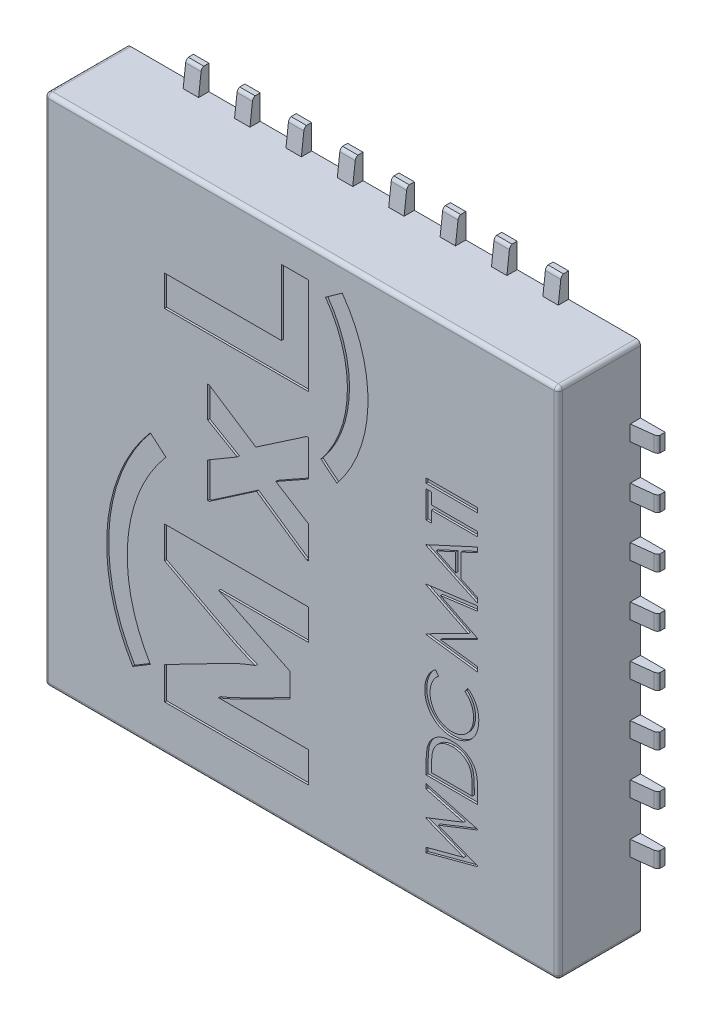
from build123d import *

# Parameters (mm, degrees)
SKETCH1_W            = 5
SKETCH1_H            = 5
BOSS_EXTRUDE1_DEPTH  = 0.8
SKETCH2_W            = 0.5
SKETCH2_H            = 0.044871795
CUT_EXTRUDE1_DEPTH   = 0.02
SKETCH3_W            = 0.15
SKETCH3_H            = 0.24
BOSS_EXTRUDE2_DEPTH  = 0.1
CUT_EXTRUDE2_DEPTH   = 6.161162759
LPATTERN1_COUNT      = 8
LPATTERN1_PITCH      = 0.5
SKETCH4_R            = 0.544852013
BOSS_EXTRUDE3_DEPTH  = 0.1
CIRPATTERN1_ANGLE    = 90
CIRPATTERN1_2_ANGLE  = 180
CIRPATTERN1_3_ANGLE  = 90
CIRPATTERN1_4_ANGLE  = 90
CIRPATTERN1_5_ANGLE  = 180
CIRPATTERN1_6_ANGLE  = 90
CIRPATTERN1_7_ANGLE  = 90
CIRPATTERN1_8_ANGLE  = 180
CIRPATTERN1_9_ANGLE  = 90
CIRPATTERN1_10_ANGLE = 90
CIRPATTERN1_11_ANGLE = 180
CIRPATTERN1_12_ANGLE = 90
CIRPATTERN1_13_ANGLE = 90
CIRPATTERN1_14_ANGLE = 180
CIRPATTERN1_15_ANGLE = 90
CIRPATTERN1_16_ANGLE = 90
CIRPATTERN1_17_ANGLE = 180
CIRPATTERN1_18_ANGLE = 90
CIRPATTERN1_19_ANGLE = 90
CIRPATTERN1_20_ANGLE = 180
CIRPATTERN1_21_ANGLE = 90
CIRPATTERN1_22_ANGLE = 90
CIRPATTERN1_23_ANGLE = 180
CIRPATTERN1_24_ANGLE = 90
FILLET3_R            = 0.04
FILLET4_R            = 0.04


with BuildPart() as part:
    # Sketch1 → Boss-Extrude1 (new body)
    with BuildSketch(Plane.XY):
        Rectangle(SKETCH1_W, SKETCH1_H)
    extrude(amount=BOSS_EXTRUDE1_DEPTH)

    # Sketch2 → Cut-Extrude1 (cut)
    # profile 1 of 12: a face of its own
    with BuildSketch(Plane.XY.offset(0.8)):
        with BuildLine():
            Line((-1.469427938, -1.810456241), (-1.640551868, -1.913977256))
            ThreePointArc((-1.640551868, -1.913977256), (-1.888188172, -0.858703712), (-1.469464766, 0.141094618))
            Line((-1.469464766, 0.141094618), (-1.317814393, 0.010702271))
            ThreePointArc((-1.317814393, 0.010702271), (-1.688877666, -0.875296541), (-1.469427938, -1.810456241))
        make_face()
    # profile 2 of 12: a face of its own
    with BuildSketch(Plane.XY.offset(0.8)):
        with BuildLine():
            Line((0.191028275, 0.749954179), (0.345848734, 0.623342072))
            ThreePointArc((0.345848734, 0.623342072), (0.647735773, 1.428628412), (0.397695478, 2.251490323))
            Line((0.397695478, 2.251490323), (0.235133187, 2.134984951))
            ThreePointArc((0.235133187, 2.134984951), (0.4478371, 1.434993984), (0.191028275, 0.749954179))
        make_face()
    # profile 3 of 12: a face of its own
    with BuildSketch(Plane.XY.offset(0.8)):
        with BuildLine():
            Line((-1.330798354, -0.558), (0.069201646, -0.558))
            Line((0.069201646, -0.558), (0.069201646, -0.856125))
            Line((0.069201646, -0.856125), (-0.804548354, -0.856125))
            add(Edge.make_bspline(
                [(-0.804548354, -0.856125), (-0.790222619, -0.861404164), (-0.75917042, -0.872847182), (-0.710342689, -0.894426012), (-0.655174384, -0.920482512), (-0.616587896, -0.939888924), (-0.596110854, -0.9501875)],
                knots=[0, 0, 0, 0, 0.80047453, 1.735093889, 2.798061757, 4, 4, 4, 4], degree=3))
            Line((-0.596110854, -0.9501875), (-0.110798354, -1.1895625))
            Line((-0.110798354, -1.1895625), (-0.110798354, -1.422375))
            Line((-0.110798354, -1.422375), (-0.596110854, -1.6658125))
            add(Edge.make_bspline(
                [(-0.596110854, -1.6658125), (-0.616791178, -1.676122895), (-0.655781757, -1.695562064), (-0.711370587, -1.721379834), (-0.759947362, -1.743017306), (-0.790540294, -1.754580418), (-0.804548354, -1.759875)],
                knots=[0, 0, 0, 0, 1.211919646, 2.284947304, 3.214702226, 4, 4, 4, 4], degree=3))
            Line((-0.804548354, -1.759875), (0.069201646, -1.759875))
            Line((0.069201646, -1.759875), (0.069201646, -2.058))
            Line((0.069201646, -2.058), (-1.330798354, -2.058))
            Line((-1.330798354, -2.058), (-1.330798354, -1.7426875))
            Line((-1.330798354, -1.7426875), (-0.720798354, -1.428))
            add(Edge.make_bspline(
                [(-0.720798354, -1.428), (-0.696922488, -1.416058329), (-0.649150405, -1.392164808), (-0.588536655, -1.36501469), (-0.540632538, -1.345189641), (-0.507106661, -1.331340531), (-0.475720433, -1.319412858), (-0.45550052, -1.312334111), (-0.445798354, -1.3089375)],
                knots=[0, 0, 0, 0, 1.602240096, 3.205845939, 3.984992466, 4.714142413, 5.383004098, 6, 6, 6, 6], degree=3))
            add(Edge.make_bspline(
                [(-0.445798354, -1.3089375), (-0.454468531, -1.306196117), (-0.472661002, -1.300443923), (-0.500914978, -1.289864605), (-0.531713821, -1.277830683), (-0.564879651, -1.263594756), (-0.60053742, -1.247830381), (-0.638294205, -1.229344035), (-0.678907836, -1.209953583), (-0.706558399, -1.195875282), (-0.720798354, -1.188625)],
                knots=[0, 0, 0, 0, 0.726111312, 1.523585883, 2.408791771, 3.366803565, 4.405774155, 5.522069931, 6.723873634, 8, 8, 8, 8], degree=3))
            Line((-0.720798354, -1.188625), (-1.330798354, -0.8689375))
            Line((-1.330798354, -0.8689375), (-1.330798354, -0.558))
        make_face()
    # profile 4 of 12: a face of its own
    with BuildSketch(Plane.XY.offset(0.8)):
        Polygon((-0.442673354, 0.53375), (0.051701646, 0.87), (0.069201646, 0.87), (0.069201646, 0.52), (-0.248610854, 0.340625), (0.069201646, 0.143125), (0.069201646, -0.17), (0.051701646, -0.17), (-0.436110854, 0.1646875), (-0.895485854, -0.15), (-0.910798354, -0.15), (-0.910798354, 0.1915625), (-0.623298354, 0.36), (-0.910798354, 0.5275), (-0.910798354, 0.83), (-0.895485854, 0.83), align=None)
    # profile 5 of 12: a face of its own
    with BuildSketch(Plane.XY.offset(0.8)):
        Polygon((-0.194235854, 1.556125), (-0.194235854, 2.198), (0.069201646, 2.198), (0.069201646, 1.258), (-1.330798354, 1.258), (-1.330798354, 1.556125), align=None)
    # profile 6 of 12: a face of its own
    with BuildSketch(Plane.XY.offset(0.8)):
        Polygon((1.213774316, -2.056738048), (1.213774316, -2.010363849), (1.580461014, -1.912507279), (1.213774316, -1.766974426), (1.213774316, -1.76046401), (1.577957008, -1.617635484), (1.213774316, -1.519278112), (1.213774316, -1.473404715), (1.713774316, -1.60822042), (1.713774316, -1.614630676), (1.331362457, -1.765071382), (1.713774316, -1.917314971), (1.713774316, -1.923725228), align=None)
    # profile 7 of 12: a face of its own
    with BuildSketch(Plane.XY.offset(0.8)):
        with BuildLine():
            Line((1.713774316, -1.400327792), (1.213774316, -1.400327792))
            Line((1.213774316, -1.400327792), (1.213774316, -1.299366253))
            add(Edge.make_bspline(
                [(1.213774316, -1.299366253), (1.21383754, -1.290584969), (1.213959689, -1.273619574), (1.214734173, -1.24910351), (1.21610424, -1.226420116), (1.218099887, -1.205643993), (1.22055032, -1.186718106), (1.223621806, -1.169695447), (1.227248688, -1.154487998), (1.230340895, -1.145135221), (1.231803162, -1.140712407)],
                knots=[0, 0, 0, 0, 1.314313732, 2.53924729, 3.670748893, 4.714932338, 5.66265055, 6.526160246, 7.303039223, 8, 8, 8, 8], degree=3))
            add(Edge.make_bspline(
                [(1.231803162, -1.140712407), (1.234006862, -1.134926923), (1.238364289, -1.123487151), (1.246596584, -1.107207983), (1.255885819, -1.091830741), (1.266445767, -1.077478027), (1.278138532, -1.064113828), (1.290880582, -1.051586464), (1.304954974, -1.040204797), (1.320111194, -1.029791559), (1.336155048, -1.02040014), (1.353060259, -1.012237568), (1.370739807, -1.005458381), (1.389144843, -0.99983079), (1.40831575, -0.995395578), (1.428274875, -0.992369589), (1.44894333, -0.990373733), (1.462968253, -0.990173154), (1.470084412, -0.990071382)],
                knots=[0, 0, 0, 0, 0.984741985, 1.947153288, 2.898543998, 3.841229145, 4.778974371, 5.722123648, 6.681464302, 7.655713756, 8.646344578, 9.637374342, 10.639946623, 11.656849581, 12.698333139, 13.76849723, 14.867749466, 16, 16, 16, 16], degree=3))
            add(Edge.make_bspline(
                [(1.470084412, -0.990071382), (1.476264589, -0.990161234), (1.488443273, -0.990338298), (1.506391973, -0.991928199), (1.523808194, -0.994239106), (1.540609019, -0.997816835), (1.556941583, -1.002160099), (1.572632046, -1.007726231), (1.587823497, -1.014103374), (1.602313628, -1.021536703), (1.616032849, -1.029708361), (1.628975358, -1.038423189), (1.640853959, -1.047878832), (1.651979923, -1.057795432), (1.662056032, -1.068412128), (1.671265962, -1.079599661), (1.679455517, -1.09140151), (1.686753389, -1.103890731), (1.693279674, -1.117234122), (1.698723379, -1.131851399), (1.703438183, -1.147673323), (1.70718881, -1.164790123), (1.710213718, -1.183140748), (1.712227713, -1.202776104), (1.713593582, -1.223659082), (1.713712901, -1.237999026), (1.713774316, -1.245379875)],
                knots=[0, 0, 0, 0, 1.106010661, 2.179509527, 3.223302912, 4.248870533, 5.252098245, 6.246278179, 7.226402005, 8.199283979, 9.158616973, 10.083547221, 10.989831858, 11.874256832, 12.749262829, 13.607058236, 14.46581075, 15.317568432, 16.194266721, 17.121067875, 18.106207572, 19.147242834, 20.255495536, 21.43354536, 22.679031616, 24, 24, 24, 24], degree=3))
            Line((1.713774316, -1.245379875), (1.713774316, -1.400327792))
        make_face()
        with BuildLine():
            Line((1.662492264, -1.355455997), (1.662492264, -1.29806417))
            add(Edge.make_bspline(
                [(1.662492264, -1.29806417), (1.662456822, -1.28981726), (1.662388653, -1.273955432), (1.661790482, -1.251147146), (1.660813062, -1.230307232), (1.659445194, -1.211432731), (1.657635391, -1.194534299), (1.655617548, -1.17957662), (1.653103627, -1.166608726), (1.650824918, -1.158761664), (1.649771912, -1.155135484)],
                knots=[0, 0, 0, 0, 1.375205317, 2.645023457, 3.804390687, 4.853969522, 5.800190428, 6.637939096, 7.370582563, 8, 8, 8, 8], degree=3))
            add(Edge.make_bspline(
                [(1.649771912, -1.155135484), (1.648164547, -1.150571432), (1.644988208, -1.14155234), (1.639194252, -1.128569334), (1.632331115, -1.116461166), (1.624702161, -1.105016969), (1.616038664, -1.09439853), (1.606527704, -1.084482095), (1.596125826, -1.075279805), (1.584849899, -1.0669334), (1.572822195, -1.059373477), (1.560021442, -1.052883601), (1.546627601, -1.047231769), (1.53253224, -1.042756542), (1.517838671, -1.039228021), (1.502470701, -1.036754725), (1.48644193, -1.035219266), (1.475529958, -1.03503621), (1.469984252, -1.034943176)],
                knots=[0, 0, 0, 0, 0.998590647, 1.973329978, 2.929871262, 3.868367705, 4.809062953, 5.754642869, 6.701828697, 7.672172887, 8.647399344, 9.630604387, 10.631475358, 11.644913558, 12.679592956, 13.747988925, 14.855477812, 16, 16, 16, 16], degree=3))
            add(Edge.make_bspline(
                [(1.469984252, -1.034943176), (1.464136611, -1.035016503), (1.452648871, -1.035160554), (1.435793057, -1.03697117), (1.419581536, -1.039617107), (1.404013222, -1.043443347), (1.389057743, -1.048319187), (1.374797813, -1.054404136), (1.361082832, -1.06135651), (1.348229351, -1.069628415), (1.336073193, -1.078687786), (1.324936776, -1.088741769), (1.314794733, -1.099630631), (1.305489117, -1.11123561), (1.297394306, -1.123883767), (1.290153352, -1.137277151), (1.284008225, -1.151612247), (1.280739816, -1.161585489), (1.279078803, -1.166653914)],
                knots=[0, 0, 0, 0, 1.122418816, 2.205001699, 3.251619955, 4.274784885, 5.280384055, 6.268708349, 7.249350384, 8.229342522, 9.199999885, 10.157847722, 11.105861043, 12.055065948, 13.010012805, 13.98527497, 14.976112212, 16, 16, 16, 16], degree=3))
            add(Edge.make_bspline(
                [(1.279078803, -1.166653914), (1.277919313, -1.170846934), (1.27545392, -1.179762447), (1.272764581, -1.194310942), (1.27039251, -1.210684535), (1.268384218, -1.228955921), (1.266943172, -1.249104272), (1.265861556, -1.271145085), (1.265132037, -1.295087885), (1.265082222, -1.31168539), (1.265056367, -1.320299747)],
                knots=[0, 0, 0, 0, 0.674548936, 1.434276114, 2.292660221, 3.240891867, 4.284742987, 5.42552168, 6.663806718, 8, 8, 8, 8], degree=3))
            Line((1.265056367, -1.320299747), (1.265056367, -1.355455997))
            Line((1.265056367, -1.355455997), (1.662492264, -1.355455997))
        make_face(mode=Mode.SUBTRACT)
    # profile 8 of 12: a face of its own
    with BuildSketch(Plane.XY.offset(0.8)):
        with BuildLine():
            Line((1.305521111, -0.46827651), (1.335569187, -0.50753933))
            add(Edge.make_bspline(
                [(1.335569187, -0.50753933), (1.332231236, -0.5103402), (1.325600336, -0.515904178), (1.316288323, -0.524855071), (1.307567142, -0.534185455), (1.299380756, -0.54388235), (1.292058193, -0.554170163), (1.285029167, -0.5646569), (1.278875013, -0.575723591), (1.271356944, -0.590949), (1.263682895, -0.610944094), (1.257082551, -0.636027643), (1.252920525, -0.662248474), (1.252466692, -0.680133162), (1.252235854, -0.689230035)],
                knots=[0, 0, 0, 0, 0.75789156, 1.505565099, 2.245254514, 2.979266606, 3.711207489, 4.440978832, 5.174393176, 5.91211879, 7.394186119, 8.890401545, 10.418332761, 12, 12, 12, 12], degree=3))
            add(Edge.make_bspline(
                [(1.252235854, -0.689230035), (1.252293563, -0.694241935), (1.252408445, -0.70421922), (1.253924035, -0.719026145), (1.256054207, -0.733556581), (1.259214968, -0.747801076), (1.263211056, -0.761741499), (1.267986116, -0.775468984), (1.273893948, -0.788784786), (1.280423706, -0.801873097), (1.287799032, -0.814413017), (1.295843883, -0.826277906), (1.304467722, -0.837425186), (1.31370476, -0.847861133), (1.323506454, -0.857605774), (1.333982614, -0.866536489), (1.345021247, -0.874772599), (1.35663152, -0.882267163), (1.368705302, -0.889014012), (1.381311526, -0.894687062), (1.394234349, -0.899641866), (1.407565384, -0.903624243), (1.421216026, -0.906751876), (1.435242826, -0.908914178), (1.44961919, -0.910412203), (1.45936336, -0.910526559), (1.464275117, -0.910584202)],
                knots=[0, 0, 0, 0, 1.054877232, 2.099964208, 3.13098259, 4.145888998, 5.169474743, 6.183358035, 7.203388855, 8.234598956, 9.261847606, 10.264062591, 11.251197969, 12.227332808, 13.196685059, 14.158975844, 15.123498106, 16.094582253, 17.066912473, 18.032714859, 19.002806091, 19.979168736, 20.95977404, 21.949109834, 22.966205168, 24, 24, 24, 24], degree=3))
            add(Edge.make_bspline(
                [(1.464275117, -0.910584202), (1.471665141, -0.910403519), (1.486174472, -0.910048773), (1.507429755, -0.906905011), (1.527811878, -0.902089384), (1.547182835, -0.894990235), (1.565704106, -0.88606193), (1.583151083, -0.874921866), (1.59977937, -0.861970888), (1.615186239, -0.847076136), (1.62925943, -0.830732016), (1.641652422, -0.813196714), (1.651983106, -0.794513214), (1.660579674, -0.774887989), (1.667187777, -0.754169971), (1.671839794, -0.732396428), (1.674874392, -0.709614715), (1.675164918, -0.694047658), (1.675312777, -0.686125067)],
                knots=[0, 0, 0, 0, 1.029159485, 2.020618137, 2.987588728, 3.942669054, 4.889339625, 5.846988364, 6.821327795, 7.821533711, 8.827683044, 9.822769455, 10.807800696, 11.797391277, 12.803701919, 13.832062008, 14.896664671, 16, 16, 16, 16], degree=3))
            add(Edge.make_bspline(
                [(1.675312777, -0.686125067), (1.675071523, -0.677396112), (1.674596677, -0.660215439), (1.670573927, -0.635020007), (1.664051367, -0.610900612), (1.654923093, -0.587855957), (1.643056623, -0.565951007), (1.628671212, -0.545151484), (1.611630022, -0.525439831), (1.598618146, -0.513586791), (1.591979444, -0.50753933)],
                knots=[0, 0, 0, 0, 1.028121516, 2.023589091, 2.998037872, 3.967518031, 4.937445131, 5.927275754, 6.942489185, 8, 8, 8, 8], degree=3))
            Line((1.591979444, -0.50753933), (1.62172704, -0.46827651))
            add(Edge.make_bspline(
                [(1.62172704, -0.46827651), (1.625803821, -0.47143635), (1.633937854, -0.477740897), (1.645407334, -0.487947542), (1.656185808, -0.49870758), (1.666219448, -0.510048669), (1.675549785, -0.521990798), (1.684181888, -0.534532871), (1.692069947, -0.547664183), (1.699315515, -0.561280433), (1.705694993, -0.575412997), (1.711348142, -0.589937459), (1.716028325, -0.604942877), (1.719987235, -0.620302936), (1.722810116, -0.63615636), (1.725058037, -0.652318865), (1.72639167, -0.668941726), (1.726526502, -0.680146482), (1.726594828, -0.685824587)],
                knots=[0, 0, 0, 0, 0.986911346, 1.969095443, 2.935967484, 3.900112155, 4.865124501, 5.834589912, 6.812044781, 7.795288262, 8.784678562, 9.777857908, 10.776141921, 11.791195789, 12.811324908, 13.855933174, 14.913475973, 16, 16, 16, 16], degree=3))
            add(Edge.make_bspline(
                [(1.726594828, -0.685824587), (1.726557401, -0.691202253), (1.726483393, -0.701835923), (1.725284512, -0.717535745), (1.723648835, -0.732819971), (1.721185959, -0.747644917), (1.718279625, -0.762091485), (1.714383731, -0.776028712), (1.710019564, -0.789593742), (1.70489028, -0.802732076), (1.699102254, -0.81545489), (1.692560603, -0.827721149), (1.685320337, -0.839525211), (1.67754105, -0.850983128), (1.668972864, -0.86192564), (1.659734773, -0.872447572), (1.649857914, -0.882607926), (1.642735792, -0.888894024), (1.639154925, -0.892054555)],
                knots=[0, 0, 0, 0, 1.114604814, 2.203992996, 3.262667896, 4.300477797, 5.318619304, 6.316056647, 7.298880507, 8.271930387, 9.238335007, 10.195173496, 11.151986948, 12.108099108, 13.064862484, 14.031167946, 15.010108607, 16, 16, 16, 16], degree=3))
            add(Edge.make_bspline(
                [(1.639154925, -0.892054555), (1.632934626, -0.897116459), (1.620569127, -0.907179157), (1.600530162, -0.920059116), (1.579626415, -0.931047532), (1.557736808, -0.940031249), (1.534852832, -0.946931791), (1.5110113, -0.951783321), (1.486259872, -0.954914006), (1.469426282, -0.955273344), (1.460869668, -0.955455997)],
                knots=[0, 0, 0, 0, 0.994611881, 1.977215934, 2.950189954, 3.921972279, 4.908960509, 5.911694611, 6.938501887, 8, 8, 8, 8], degree=3))
            add(Edge.make_bspline(
                [(1.460869668, -0.955455997), (1.451876032, -0.955233826), (1.434181614, -0.95479672), (1.408213907, -0.951083035), (1.383335135, -0.945108921), (1.359591743, -0.936623651), (1.336858846, -0.925865744), (1.315310103, -0.912576228), (1.294807703, -0.896909493), (1.275662738, -0.878988412), (1.258157116, -0.859335935), (1.24275623, -0.838290391), (1.229939442, -0.81589297), (1.219225705, -0.792390419), (1.210990781, -0.767606751), (1.20522604, -0.741594841), (1.201637881, -0.714403567), (1.20118428, -0.695851792), (1.200953803, -0.686425548)],
                knots=[0, 0, 0, 0, 1.032925535, 2.032216505, 3.007276963, 3.968222605, 4.92396291, 5.891752235, 6.871517503, 7.883894988, 8.900124299, 9.891468569, 10.874487609, 11.85992873, 12.854644235, 13.869047385, 14.917252991, 16, 16, 16, 16], degree=3))
            add(Edge.make_bspline(
                [(1.200953803, -0.686425548), (1.20102274, -0.680680642), (1.201159193, -0.66930918), (1.202487774, -0.6524871), (1.204707195, -0.636110628), (1.207712146, -0.620162544), (1.211496276, -0.604596738), (1.216212514, -0.589442333), (1.221827526, -0.574736438), (1.22823961, -0.56048383), (1.235449962, -0.546780722), (1.243373533, -0.533635717), (1.251970288, -0.521101221), (1.261328238, -0.509242381), (1.27136976, -0.49804469), (1.281977231, -0.48734204), (1.293422849, -0.477445974), (1.301480974, -0.471338593), (1.305521111, -0.46827651)],
                knots=[0, 0, 0, 0, 1.096622143, 2.170653093, 3.219033441, 4.250379162, 5.267604342, 6.275621678, 7.278284436, 8.271072515, 9.257558938, 10.232633088, 11.19973724, 12.157384997, 13.114417402, 14.069920322, 15.032307892, 16, 16, 16, 16], degree=3))
        make_face()
    # profile 9 of 12: a face of its own
    with BuildSketch(Plane.XY.offset(0.8)):
        Polygon((1.713774316, -0.283661125), (1.213774316, -0.217655516), (1.213774316, -0.21124526), (1.624030726, -0.004814971), (1.213774316, 0.201114516), (1.213774316, 0.207624933), (1.713774316, 0.274031183), (1.713774316, 0.228959067), (1.353998675, 0.181082465), (1.713774316, 0.000593683), (1.713774316, -0.009522503), (1.353197393, -0.190712407), (1.713774316, -0.238488849), align=None)
    # profile 10 of 12: a face of its own
    with BuildSketch(Plane.XY.offset(0.8)):
        Polygon((1.213774316, 0.539415798), (1.713774316, 0.770185029), (1.713774316, 0.721406984), (1.553517905, 0.647488715), (1.553517905, 0.420826054), (1.713774316, 0.34480442), (1.713774316, 0.295826054), (1.213774316, 0.533005542), align=None)
        Polygon((1.311230245, 0.535709868), (1.502235854, 0.445164997), (1.502235854, 0.623850894), align=None, mode=Mode.SUBTRACT)
    # profile 11 of 12: a face of its own
    with BuildSketch(Plane.XY.offset(0.8)):
        Polygon((1.265056367, 0.747108106), (1.213774316, 0.747108106), (1.213774316, 1.009928618), (1.265056367, 1.009928618), (1.265056367, 0.90095426), (1.713774316, 0.90095426), (1.713774316, 0.856082465), (1.265056367, 0.856082465), align=None)
    # profile 12 of 12: a face of its own
    with BuildSketch(Plane.XY.offset(0.8)):
        with Locations((1.463774316, 1.079800414)):
            Rectangle(SKETCH2_W, SKETCH2_H)
    extrude(amount=-CUT_EXTRUDE1_DEPTH, mode=Mode.SUBTRACT)

    # Fillet3
    fillet3_edges = [part.edges().sort_by_distance(p)[0] for p in [
        (-2.5, 2.5, 0.4),
        (2.5, 2.5, 0.4),
        (2.5, -2.5, 0.4),
        (-2.5, -2.5, 0.4),
    ]]
    fillet(fillet3_edges, radius=FILLET3_R)

    # Fillet4
    fillet4_edges = [part.edges().sort_by_distance(p)[0] for p in [
        (-2.5, 0, 0.8),
        (0, 2.5, 0.8),
        (0, -2.5, 0.8),
        (2.5, 0, 0.8),
        (-2.488284271, -2.488284271, 0.8),
        (2.488284271, -2.488284271, 0.8),
        (2.488284271, 2.488284271, 0.8),
        (-2.488284271, 2.488284271, 0.8),
    ]]
    fillet(fillet4_edges, radius=FILLET4_R)


with BuildPart() as body_2:
    # Sketch3 → Boss-Extrude2 (new body)
    with BuildSketch(Plane(origin=(0, 0, 0), x_dir=(-1, 0, 0), z_dir=(0, 0, -1))):
        with Locations((1.725, -2.62)):
            Rectangle(SKETCH3_W, SKETCH3_H)
    extrude(amount=-BOSS_EXTRUDE2_DEPTH)

    # Sketch6 → Cut-Extrude2 (cut, through all)
    with BuildSketch(Plane.ZY.offset(1.8)):
        with BuildLine():
            Line((0.1, -2.5), (0.075723203, -2.706241929))
            ThreePointArc((0.075723203, -2.706241929), (0.067478156, -2.726638718), (0.05, -2.74))
            Line((0.05, -2.74), (0.143873147, -2.798336448))
            Line((0.143873147, -2.798336448), (0.1, -2.5))
        make_face()
    extrude(amount=-CUT_EXTRUDE2_DEPTH, mode=Mode.SUBTRACT)


with BuildPart() as lpattern1_1:
    # LPattern1: pattern copy
    add(body_2.part.moved(Location(Vector(1, 0, 0) * (1 * LPATTERN1_PITCH))))


with BuildPart() as lpattern1_2:
    # LPattern1: pattern copy
    add(body_2.part.moved(Location(Vector(1, 0, 0) * (2 * LPATTERN1_PITCH))))


with BuildPart() as lpattern1_3:
    # LPattern1: pattern copy
    add(body_2.part.moved(Location(Vector(1, 0, 0) * (3 * LPATTERN1_PITCH))))


with BuildPart() as lpattern1_4:
    # LPattern1: pattern copy
    add(body_2.part.moved(Location(Vector(1, 0, 0) * (4 * LPATTERN1_PITCH))))


with BuildPart() as lpattern1_5:
    # LPattern1: pattern copy
    add(body_2.part.moved(Location(Vector(1, 0, 0) * (5 * LPATTERN1_PITCH))))


with BuildPart() as lpattern1_6:
    # LPattern1: pattern copy
    add(body_2.part.moved(Location(Vector(1, 0, 0) * (6 * LPATTERN1_PITCH))))


with BuildPart() as lpattern1_7:
    # LPattern1: pattern copy
    add(body_2.part.moved(Location(Vector(1, 0, 0) * (7 * LPATTERN1_PITCH))))


with BuildPart() as body_10:
    # Sketch4 → Boss-Extrude3 (new body)
    with BuildSketch(Plane(origin=(0, 0, 0), x_dir=(-1, 0, 0), z_dir=(0, 0, -1))):
        Circle(SKETCH4_R)
    extrude(amount=BOSS_EXTRUDE3_DEPTH)


with BuildPart() as body_11:
    # CirPattern1: read off the stored shape, not the designer's step
    # CirPattern1: copy of LPattern1_7
    add(lpattern1_7.part.rotate(Axis((0, 0, 0), (0, 0, -1)), CIRPATTERN1_ANGLE))


with BuildPart() as body_12:
    # CirPattern1 2: copy of LPattern1_7
    add(lpattern1_7.part.rotate(Axis((0, 0, 0), (0, 0, 1)), CIRPATTERN1_2_ANGLE))


with BuildPart() as body_13:
    # CirPattern1 3: copy of LPattern1_7
    add(lpattern1_7.part.rotate(Axis((0, 0, 0), (0, 0, 1)), CIRPATTERN1_3_ANGLE))


with BuildPart() as body_14:
    # CirPattern1 4: copy of LPattern1_7
    add(lpattern1_7.part.moved(Location((-0.5, 0, 0))).rotate(Axis((0, 0, 0), (0, 0, -1)), CIRPATTERN1_4_ANGLE))


with BuildPart() as body_15:
    # CirPattern1 5: copy of LPattern1_7
    add(lpattern1_7.part.moved(Location((-0.5, 0, 0))).rotate(Axis((0, 0, 0), (0, 0, 1)), CIRPATTERN1_5_ANGLE))


with BuildPart() as body_16:
    # CirPattern1 6: copy of LPattern1_7
    add(lpattern1_7.part.moved(Location((-0.5, 0, 0))).rotate(Axis((0, 0, 0), (0, 0, 1)), CIRPATTERN1_6_ANGLE))


with BuildPart() as body_17:
    # CirPattern1 7: copy of LPattern1_7
    add(lpattern1_7.part.moved(Location((-1, 0, 0))).rotate(Axis((0, 0, 0), (0, 0, -1)), CIRPATTERN1_7_ANGLE))


with BuildPart() as body_18:
    # CirPattern1 8: copy of LPattern1_7
    add(lpattern1_7.part.moved(Location((-1, 0, 0))).rotate(Axis((0, 0, 0), (0, 0, 1)), CIRPATTERN1_8_ANGLE))


with BuildPart() as body_19:
    # CirPattern1 9: copy of LPattern1_7
    add(lpattern1_7.part.moved(Location((-1, 0, 0))).rotate(Axis((0, 0, 0), (0, 0, 1)), CIRPATTERN1_9_ANGLE))


with BuildPart() as body_20:
    # CirPattern1 10: copy of LPattern1_7
    add(lpattern1_7.part.moved(Location((-1.5, 0, 0))).rotate(Axis((0, 0, 0), (0, 0, -1)), CIRPATTERN1_10_ANGLE))


with BuildPart() as body_21:
    # CirPattern1 11: copy of LPattern1_7
    add(lpattern1_7.part.moved(Location((-1.5, 0, 0))).rotate(Axis((0, 0, 0), (0, 0, 1)), CIRPATTERN1_11_ANGLE))


with BuildPart() as body_22:
    # CirPattern1 12: copy of LPattern1_7
    add(lpattern1_7.part.moved(Location((-1.5, 0, 0))).rotate(Axis((0, 0, 0), (0, 0, 1)), CIRPATTERN1_12_ANGLE))


with BuildPart() as body_23:
    # CirPattern1 13: copy of LPattern1_7
    add(lpattern1_7.part.moved(Location((-2.5, 0, 0))).rotate(Axis((0, 0, 0), (0, 0, -1)), CIRPATTERN1_13_ANGLE))


with BuildPart() as body_24:
    # CirPattern1 14: copy of LPattern1_7
    add(lpattern1_7.part.moved(Location((-2.5, 0, 0))).rotate(Axis((0, 0, 0), (0, 0, 1)), CIRPATTERN1_14_ANGLE))


with BuildPart() as body_25:
    # CirPattern1 15: copy of LPattern1_7
    add(lpattern1_7.part.moved(Location((-2.5, 0, 0))).rotate(Axis((0, 0, 0), (0, 0, 1)), CIRPATTERN1_15_ANGLE))


with BuildPart() as body_26:
    # CirPattern1 16: copy of LPattern1_7
    add(lpattern1_7.part.moved(Location((-2, 0, 0))).rotate(Axis((0, 0, 0), (0, 0, -1)), CIRPATTERN1_16_ANGLE))


with BuildPart() as body_27:
    # CirPattern1 17: copy of LPattern1_7
    add(lpattern1_7.part.moved(Location((-2, 0, 0))).rotate(Axis((0, 0, 0), (0, 0, 1)), CIRPATTERN1_17_ANGLE))


with BuildPart() as body_28:
    # CirPattern1 18: copy of LPattern1_7
    add(lpattern1_7.part.moved(Location((-2, 0, 0))).rotate(Axis((0, 0, 0), (0, 0, 1)), CIRPATTERN1_18_ANGLE))


with BuildPart() as body_29:
    # CirPattern1 19: copy of LPattern1_7
    add(lpattern1_7.part.moved(Location((-3, 0, 0))).rotate(Axis((0, 0, 0), (0, 0, -1)), CIRPATTERN1_19_ANGLE))


with BuildPart() as body_30:
    # CirPattern1 20: copy of LPattern1_7
    add(lpattern1_7.part.moved(Location((-3, 0, 0))).rotate(Axis((0, 0, 0), (0, 0, 1)), CIRPATTERN1_20_ANGLE))


with BuildPart() as body_31:
    # CirPattern1 21: copy of LPattern1_7
    add(lpattern1_7.part.moved(Location((-3, 0, 0))).rotate(Axis((0, 0, 0), (0, 0, 1)), CIRPATTERN1_21_ANGLE))


with BuildPart() as body_32:
    # CirPattern1 22: copy of LPattern1_7
    add(lpattern1_7.part.moved(Location((-3.5, 0, 0))).rotate(Axis((0, 0, 0), (0, 0, -1)), CIRPATTERN1_22_ANGLE))


with BuildPart() as body_33:
    # CirPattern1 23: copy of LPattern1_7
    add(lpattern1_7.part.moved(Location((-3.5, 0, 0))).rotate(Axis((0, 0, 0), (0, 0, 1)), CIRPATTERN1_23_ANGLE))


with BuildPart() as body_34:
    # CirPattern1 24: copy of LPattern1_7
    add(lpattern1_7.part.moved(Location((-3.5, 0, 0))).rotate(Axis((0, 0, 0), (0, 0, 1)), CIRPATTERN1_24_ANGLE))


solid = Compound([part.part, body_2.part, lpattern1_1.part, lpattern1_2.part, lpattern1_3.part, lpattern1_4.part, lpattern1_5.part, lpattern1_6.part, lpattern1_7.part, body_10.part, body_11.part, body_12.part, body_13.part, body_14.part, body_15.part, body_16.part, body_17.part, body_18.part, body_19.part, body_20.part, body_21.part, body_22.part, body_23.part, body_24.part, body_25.part, body_26.part, body_27.part, body_28.part, body_29.part, body_30.part, body_31.part, body_32.part, body_33.part, body_34.part])
